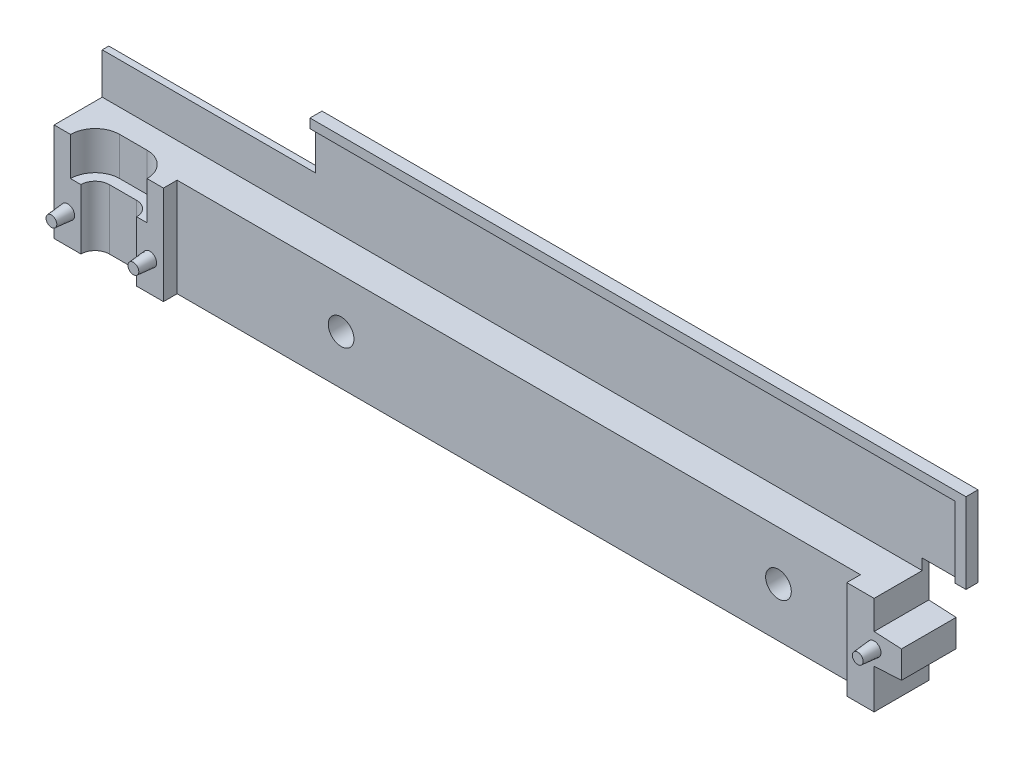
from build123d import *
from OCP.BRepFilletAPI import BRepFilletAPI_MakeChamfer

# Parameters (mm, degrees)
BOSS_EXTRUDE1_DEPTH      = 10
BOSS_EXTRUDE1_DEPTH_BACK = 10
CUT_EXTRUDE1_DEPTH       = 157
CUT_EXTRUDE4_DEPTH       = 2.5
CUT_EXTRUDE4_DEPTH_BACK  = 2.5
SKETCH8_W                = 125
SKETCH8_H                = 34.7
CUT_EXTRUDE5_DEPTH       = 131.593280003
CUT_EXTRUDE5_DEPTH_BACK  = 131.593280003
SKETCH9_R                = 2.35
CHAMFER2_SIZE            = 5
CHAMFER2_SIZE_2          = 0.262038896
CUT_EXTRUDE8_DEPTH       = 7
CUT_EXTRUDE9_DEPTH       = 131.381798599
SKETCH16_W               = 214.344642296
SKETCH16_H               = 84.645654919
CUT_EXTRUDE10_DEPTH      = 131.593280003
SKETCH17_W               = 2
SKETCH17_H               = 14.7
CUT_EXTRUDE11_DEPTH      = 7.8
SKETCH19_R               = 1.25
BOSS_EXTRUDE5_DEPTH      = 3
BOSS_EXTRUDE5_2_DEPTH    = 3
BOSS_EXTRUDE5_3_DEPTH    = 3
CHAMFER3_SIZE            = 3
CHAMFER3_SIZE_2          = 0.262465991
CHAMFER4_SIZE            = 3
CHAMFER4_SIZE_2          = 0.262465991
CHAMFER5_SIZE            = 3
CHAMFER5_SIZE_2          = 0.262465991


# Some blends are built 0.0001 mm under size
with BuildPart() as part:
    # Sketch1 → Boss-Extrude1 (new, two sides: drawn at the far end of the back side and taken through both)
    with BuildSketch(Plane.XY.offset(-BOSS_EXTRUDE1_DEPTH_BACK)):
        Polygon((-127.819104229, -9.862903226), (22.180895771, -9.862903226), (22.180895771, -2.612903226), (27.180895771, -2.612903226), (27.180895771, 2.887096774), (22.180895771, 2.887096774), (22.180895771, 10.137096774), (31.180895771, 10.137096774), (31.180895771, 23.637096774), (31.180895771, 24.837096774), (-88.819104229, 24.837096774), (-88.819104229, 23.637096774), (-88.819104229, 15.637096774), (-127.819104229, 15.637096774), align=None)
    extrude(amount=BOSS_EXTRUDE1_DEPTH + BOSS_EXTRUDE1_DEPTH_BACK)

    # Sketch2 → Cut-Extrude1 (cut)
    with BuildSketch(Plane.ZY.offset(127.819104229)):
        Polygon((-8.8, 23.137096774), (-8.8, 8.137096774), (8.8, 8.137096774), (8.8, 23.137096774), (7.8, 23.137096774), (7.8, 24.837096774), (-7.8, 24.837096774), (-7.8, 23.137096774), align=None)
    extrude(amount=-CUT_EXTRUDE1_DEPTH, mode=Mode.SUBTRACT)

    # Sketch8 → Cut-Extrude4 (cut, two sides: drawn at the far end of the back side and taken through both)
    with BuildSketch(Plane.XY.offset(-CUT_EXTRUDE4_DEPTH_BACK)):
        with Locations((-45.319104229, 7.487096774)):
            Rectangle(SKETCH8_W, SKETCH8_H)
    extrude(amount=CUT_EXTRUDE4_DEPTH + CUT_EXTRUDE4_DEPTH_BACK, mode=Mode.SUBTRACT)

    # Sketch9 → Cut-Extrude5 (cut, two sides: drawn at the far end of the back side and taken through both)
    with BuildSketch(Plane.XY.offset(-CUT_EXTRUDE5_DEPTH_BACK)):
        with Locations((-77.819104229, -0.862903226)):
            Circle(SKETCH9_R)
        with Locations((2.180895771, -0.862903226)):
            Circle(SKETCH9_R)
    extrude(amount=CUT_EXTRUDE5_DEPTH + CUT_EXTRUDE5_DEPTH_BACK, mode=Mode.SUBTRACT)

    # Chamfer2
    chamfer2_edges_1 = [part.edges().sort_by_distance(p)[0] for p in [
        (27.180895771, -2.612903226, 0),
    ]]
    chamfer2_side_1 = [part.faces().sort_by_distance(p)[0] for p in [
        (27.175654993, -2.612903226, 0),
    ]]
    chamfer2_edges_2 = [part.edges().sort_by_distance(p)[0] for p in [
        (27.180895771, 2.887096774, 0),
    ]]
    chamfer2_side_2 = [part.faces().sort_by_distance(p)[0] for p in [
        (27.180895771, 2.881855996, 0),
    ]]
    chamfer2 = BRepFilletAPI_MakeChamfer(part.part.solid().wrapped)
    for e in chamfer2_edges_1:
        chamfer2.Add(CHAMFER2_SIZE - 0.0001, CHAMFER2_SIZE_2 - 0.0001, e.wrapped, chamfer2_side_1[0].wrapped)
    for e in chamfer2_edges_2:
        chamfer2.Add(CHAMFER2_SIZE_2 - 0.0001, CHAMFER2_SIZE - 0.0001, e.wrapped, chamfer2_side_2[0].wrapped)
    add(Compound.cast(chamfer2.Shape()), mode=Mode.REPLACE)  # a hair under: the kernel refuses the full size

    # Sketch14 → Cut-Extrude8 (cut)
    with BuildSketch(Plane(origin=(0, 8.137096774, 0), x_dir=(1, 0, 0), z_dir=(0, 1, 0))):
        with BuildLine():
            Line((-120.319104229, 4.5), (-115.319104229, 4.5))
            ThreePointArc((-115.319104229, 4.5), (-110.819104229, 0), (-115.319104229, -4.5))
            Line((-115.319104229, -4.5), (-120.319104229, -4.5))
            ThreePointArc((-120.319104229, -4.5), (-124.819104229, 0), (-120.319104229, 4.5))
        make_face()
    extrude(amount=-CUT_EXTRUDE8_DEPTH, mode=Mode.SUBTRACT)

    # Sketch15 → Cut-Extrude9 (cut, through all)
    with BuildSketch(Plane(origin=(0, 1.137096774, 0), x_dir=(1, 0, 0), z_dir=(0, 1, 0))):
        with BuildLine():
            Line((-120.319104229, -2.6), (-115.319104229, -2.6))
            ThreePointArc((-115.319104229, -2.6), (-112.719104229, 0), (-115.319104229, 2.6))
            Line((-115.319104229, 2.6), (-120.319104229, 2.6))
            ThreePointArc((-120.319104229, 2.6), (-122.919104229, 0), (-120.319104229, -2.6))
        make_face()
    extrude(amount=-CUT_EXTRUDE9_DEPTH, mode=Mode.SUBTRACT)

    # Sketch16 → Cut-Extrude10 (cut, through all)
    with BuildSketch(Plane.XY):
        with Locations((-30.272765953, 16.776086779)):
            Rectangle(SKETCH16_W, SKETCH16_H)
    extrude(amount=CUT_EXTRUDE10_DEPTH, mode=Mode.SUBTRACT)

    # Sketch17 → Cut-Extrude11 (cut)
    with BuildSketch(Plane.XY):
        with Locations((30.180895771, 17.487096774)):
            Rectangle(SKETCH17_W, SKETCH17_H)
    extrude(amount=-CUT_EXTRUDE11_DEPTH, mode=Mode.SUBTRACT)


with BuildPart() as body_2:
    # Sketch19 → Boss-Extrude5 (new body)
    with BuildSketch(Plane.XY):
        with Locations((-125.319104229, -4.362903226)):
            Circle(SKETCH19_R)
    extrude(amount=BOSS_EXTRUDE5_DEPTH)

    # Chamfer5
    # the kernel refuses this chamfer: 3, 0.262465991 mm, written as the material it takes off along each edge
    with BuildSketch(Plane(origin=(-125.319104229, -4.362903226, 3), x_dir=(1, 0, 0), z_dir=(0, -1, 0))) as chamfer5_piece_1:
        Polygon((1.25, -CHAMFER5_SIZE), (1.25 - CHAMFER5_SIZE_2 * 0.999999998391, 0), (1.25, 0), align=None)
    revolve(axis=Axis((-125.319104229, -4.362903226, 3), (0, 0, 1)), mode=Mode.SUBTRACT)


with BuildPart() as body_3:
    # Sketch19 → Boss-Extrude5 2 (new body)
    with BuildSketch(Plane.XY):
        with Locations((-110.319104229, -4.362903226)):
            Circle(SKETCH19_R)
    extrude(amount=BOSS_EXTRUDE5_2_DEPTH)

    # Chamfer4
    # the kernel refuses this chamfer: 3, 0.262465991 mm, written as the material it takes off along each edge
    with BuildSketch(Plane(origin=(-110.319104229, -4.362903226, 3), x_dir=(1, 0, 0), z_dir=(0, -1, 0))) as chamfer4_piece_1:
        Polygon((1.25, -CHAMFER4_SIZE), (1.25 - CHAMFER4_SIZE_2 * 0.999999998391, 0), (1.25, 0), align=None)
    revolve(axis=Axis((-110.319104229, -4.362903226, 3), (0, 0, 1)), mode=Mode.SUBTRACT)


with BuildPart() as body_4:
    # Sketch19 → Boss-Extrude5 3 (new body)
    with BuildSketch(Plane.XY):
        with Locations((22.180895771, 0.137096774)):
            Circle(SKETCH19_R)
    extrude(amount=BOSS_EXTRUDE5_3_DEPTH)

    # Chamfer3
    # the kernel refuses this chamfer: 3, 0.262465991 mm, written as the material it takes off along each edge
    with BuildSketch(Plane(origin=(22.180895771, 0.137096774, 3), x_dir=(1, 0, 0), z_dir=(0, -1, 0))) as chamfer3_piece_1:
        Polygon((1.25, -CHAMFER3_SIZE), (1.25 - CHAMFER3_SIZE_2 * 0.999999998391, 0), (1.25, 0), align=None)
    revolve(axis=Axis((22.180895771, 0.137096774, 3), (0, 0, 1)), mode=Mode.SUBTRACT)


solid = Compound([part.part, body_2.part, body_3.part, body_4.part])
